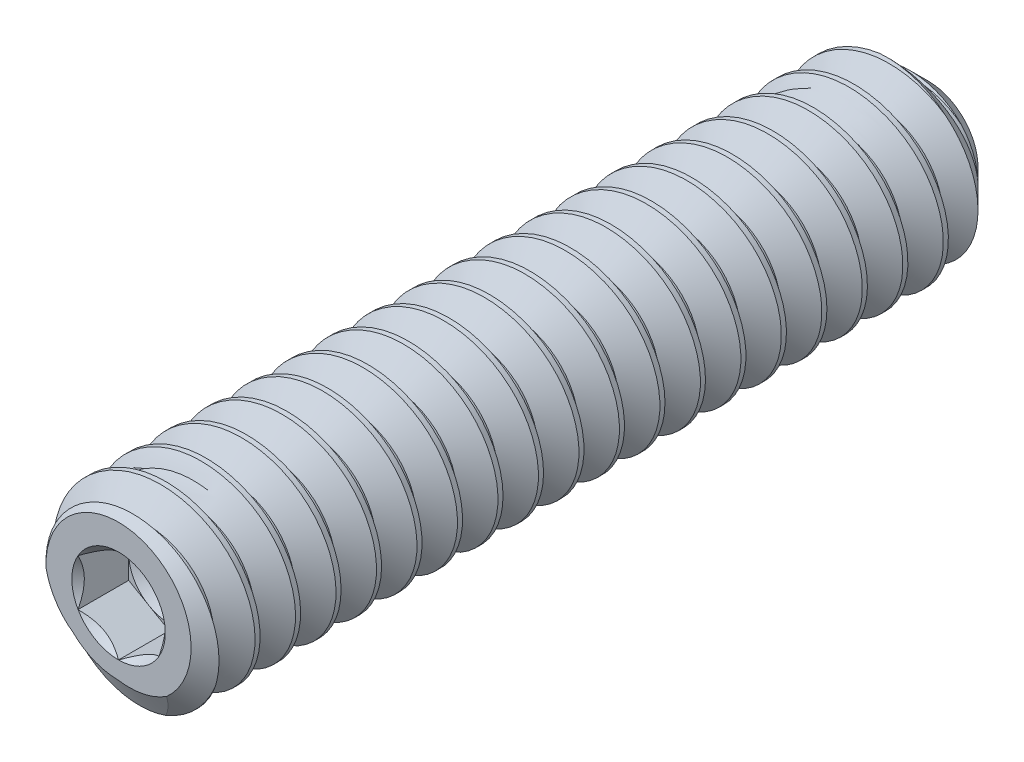
from build123d import *

# Parameters (mm, degrees)
CUT_SWEEP2_PITCH    = 0.635
CUT_EXTRUDE10_DEPTH = 0.79375


with BuildPart() as part:
    # Sketch22 → Revolve1 (revolve)
    with BuildSketch(Plane(origin=(0, 0, 0), x_dir=(0, 0, -1), z_dir=(1, 0, 0)), mode=Mode.PRIVATE) as revolve1_sk:
        Polygon((-6.115837021, 0), (-6.115837021, 1.13792), (-5.916641981, 1.4224), (5.941188262, 1.4224), (6.584162979, 0.779425283), (6.115837021, 0), align=None)
    revolve(revolve1_sk.sketch.rotate(Axis((0, 0, -6.115837021), (0, 0, -1)), 180), axis=Axis((0, 0, -6.115837021), (0, 0, -1)))

    # Cut-Sweep2: the profile of Sketch28 profile screwed along a right-hand helix of 21 turns, 6 arcs to a turn; built about Z, then put on its axis
    cut_sweep2_z = Axis((0, 0, 0), (0, 0, 1))
    cut_sweep2_corners = [(1.4227, 0, 0.000173205), (1.4227, 0, -0.555798205), (1.009955401, 0, -0.3175), (1.009955401, 0, -0.238125)]
    with BuildLine(mode=Mode.PRIVATE) as cut_sweep2_profile:
        Line(cut_sweep2_corners[0], cut_sweep2_corners[1])
        Line(cut_sweep2_corners[1], cut_sweep2_corners[2])
        Line(cut_sweep2_corners[2], cut_sweep2_corners[3])
        Line(cut_sweep2_corners[3], cut_sweep2_corners[0])
    cut_sweep2_cap = Face(cut_sweep2_profile.wire())
    cut_sweep2_turn_angles = [0, 30, 60, 90, 120, 150, 180, 210, 240, 270, 300, 330, 360]
    cut_sweep2_turn_weights = [1, 0.8660254037844387, 1, 0.8660254037844387, 1, 0.8660254037844387, 1, 0.8660254037844387, 1, 0.8660254037844387, 1, 0.8660254037844387, 1]
    cut_sweep2_turn_rails = [Edge.make_bspline([Vector(p[0], p[1], 0).rotate(cut_sweep2_z, cut_sweep2_turn_angles[k]) / cut_sweep2_turn_weights[k] + Vector(0, 0, p[2] + CUT_SWEEP2_PITCH * cut_sweep2_turn_angles[k] / 360) for k in range(13)], [0, 0, 0, 1, 1, 2, 2, 3, 3, 4, 4, 5, 5, 6, 6, 6], 2, cut_sweep2_turn_weights) for p in cut_sweep2_corners]
    cut_sweep2_turn_sides = [Face.make_surface_from_curves(cut_sweep2_turn_rails[p[0]], cut_sweep2_turn_rails[p[1]]) for p in [(0, 1), (1, 2), (2, 3), (3, 0)]]
    cut_sweep2 = Plane(origin=(0, 0, -6.584162979), x_dir=(0, 1, 0), z_dir=(0, 0, 1)) * Solid(Shell([*[p.moved(Location((0, 0, CUT_SWEEP2_PITCH * i))) for i in range(21) for p in cut_sweep2_turn_sides], cut_sweep2_cap, cut_sweep2_cap.rotate(cut_sweep2_z, 7560).moved(Location((0, 0, CUT_SWEEP2_PITCH * 7560 / 360)))]))
    add(cut_sweep2, mode=Mode.SUBTRACT)

    # Sketch23 → Cut-Extrude10 (cut)
    with BuildSketch(Plane.XY.offset(6.115837021)):
        Polygon((0, 0.733234842), (-0.635, 0.366617421), (-0.635, -0.366617421), (0, -0.733234842), (0.635, -0.366617421), (0.635, 0.366617421), align=None)
    extrude(amount=-CUT_EXTRUDE10_DEPTH, mode=Mode.SUBTRACT)

    # Cut-Extrude11 cone 1 section (through the dimple's axis) → Cut-Extrude11 (revolve, cut)
    with BuildSketch(Plane(origin=(0, 0, 6.115837021), x_dir=(0, -1, 0), z_dir=(1, 0, 0))):
        Polygon((0, 0), (0.733234842, 0), (0, 0.733234842), align=None)
    revolve(axis=Axis((0, 0, 6.115837021), (0, 0, -1)), mode=Mode.SUBTRACT)

    # Cut-Extrude12 cone 1 section (through the dimple's axis) → Cut-Extrude12 (revolve, cut)
    with BuildSketch(Plane(origin=(0, 0, 5.322087021), x_dir=(0, -1, 0), z_dir=(1, 0, 0))):
        Polygon((0, 0), (0.635, 0), (0, 0.366617421), align=None)
    revolve(axis=Axis((0, 0, 5.322087021), (0, 0, -1)), mode=Mode.SUBTRACT)


solid = part.part
